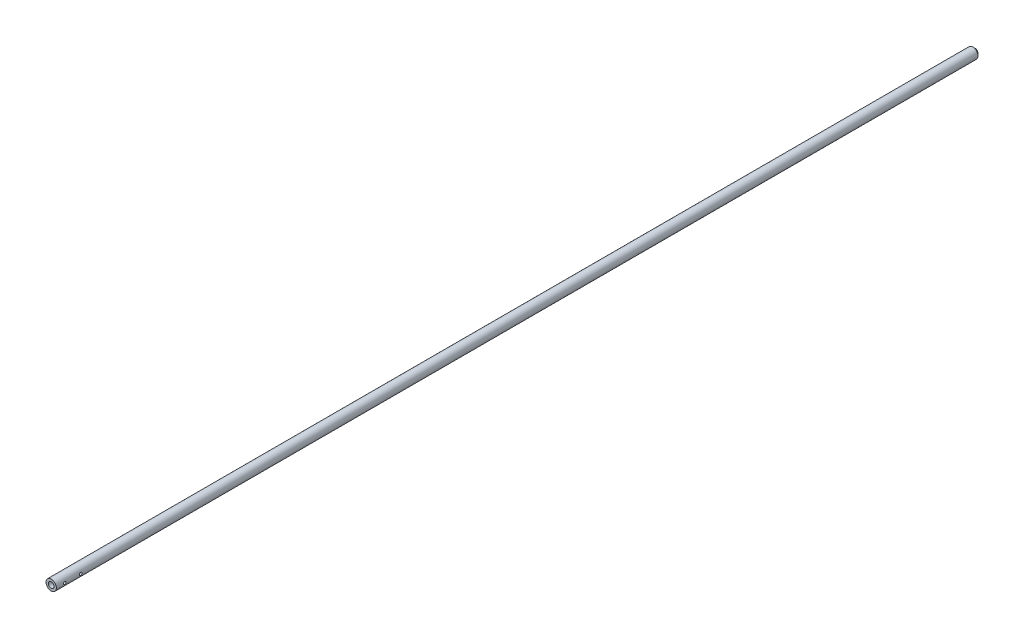
from build123d import *

# Parameters (mm, degrees)
SKETCH1_R           = 1.5875
SKETCH1_R_2         = 0.8763
BOSS_EXTRUDE1_DEPTH = 282.575
SKETCH3_R           = 0.396875
CUT_EXTRUDE1_DEPTH  = 2.159
CHAMFER1_SIZE       = 0.762


with BuildPart() as part:
    # Sketch1 → Boss-Extrude1 (new body)
    with BuildSketch(Plane.XY):
        Circle(SKETCH1_R)
        Circle(SKETCH1_R_2, mode=Mode.SUBTRACT)
    extrude(amount=BOSS_EXTRUDE1_DEPTH)

    # Sketch3 → Cut-Extrude1 (cut, symmetric)
    with BuildSketch(Plane(origin=(0, 0, 0), x_dir=(0, 0, -1), z_dir=(1, 0, 0))):
        with Locations((-279.9969, 0)):
            Circle(SKETCH3_R)
        with Locations((-275.082, 0)):
            Circle(SKETCH3_R)
    extrude(amount=CUT_EXTRUDE1_DEPTH, both=True, mode=Mode.SUBTRACT)

    # Chamfer1
    # the kernel refuses this chamfer: 0.762 mm, written as the material it takes off along each edge
    with BuildSketch(Plane(origin=(0, 0, 0), x_dir=(1, 0, 0), z_dir=(0, -1, 0))) as chamfer1_piece_1:
        Polygon((1.5875, CHAMFER1_SIZE), (1.5875 - CHAMFER1_SIZE, 0), (1.5875, 0), align=None)
    revolve(axis=Axis((0, 0, 0), (0, 0, 1)), mode=Mode.SUBTRACT)


solid = part.part
